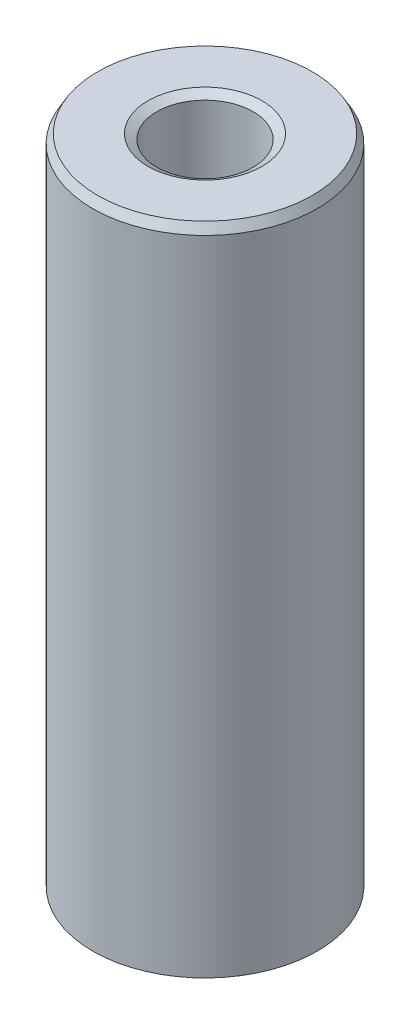
from build123d import *
from OCP.BRepFilletAPI import BRepFilletAPI_MakeChamfer

# Parameters (mm, degrees)
SKETCH1_R           = 32.5
BOSS_EXTRUDE1_DEPTH = 190.020085053
SKETCH2_R           = 13.937370065
CUT_EXTRUDE1_DEPTH  = 196.49970006
CHAMFER1_SIZE       = 2.545551972
CHAMFER1_SIZE2      = 1.469675116


with BuildPart() as part:
    # Sketch1 → Boss-Extrude1 (new body)
    with BuildSketch(Plane(origin=(0, 0, 0), x_dir=(1, 0, 0), z_dir=(0, 1, 0))):
        Circle(SKETCH1_R)
    extrude(amount=BOSS_EXTRUDE1_DEPTH)

    # Sketch2 → Cut-Extrude1 (cut, through all)
    with BuildSketch(Plane(origin=(0, 0, 0), x_dir=(1, 0, 0), z_dir=(0, 1, 0))):
        Circle(SKETCH2_R)
    extrude(amount=CUT_EXTRUDE1_DEPTH, mode=Mode.SUBTRACT)

    # Chamfer1: one chamfer whose edges measure the first distance from different faces: ONE call of the kernel's chamfer builder (chamfer() names one face for all edges)
    chamfer1_edges_1 = [part.edges().sort_by_distance(p)[0] for p in [
        (-13.937370065, 190.020085053, 0),
    ]]
    chamfer1_side_1 = [part.faces().sort_by_distance(p)[0] for p in [
        (-31.580761184, 190.020085053, 0),
    ]]
    chamfer1_edges_2 = [part.edges().sort_by_distance(p)[0] for p in [
        (-13.937370065, 0, 0),
    ]]
    chamfer1_side_2 = [part.faces().sort_by_distance(p)[0] for p in [
        (-13.937370065, 95.010042527, 0),
    ]]
    chamfer1_edges_3 = [part.edges().sort_by_distance(p)[0] for p in [
        (-32.5, 0, 0),
    ]]
    chamfer1_side_3 = [part.faces().sort_by_distance(p)[0] for p in [
        (-31.580761184, 0, 0),
    ]]
    chamfer1_edges_4 = [part.edges().sort_by_distance(p)[0] for p in [
        (-32.5, 190.020085053, 0),
    ]]
    chamfer1_side_4 = [part.faces().sort_by_distance(p)[0] for p in [
        (-32.5, 95.010042527, 0),
    ]]
    chamfer1 = BRepFilletAPI_MakeChamfer(part.part.solid().wrapped)
    for e in chamfer1_edges_1:
        chamfer1.Add(CHAMFER1_SIZE, CHAMFER1_SIZE2, e.wrapped, chamfer1_side_1[0].wrapped)  # the first distance lies on this face
    for e in chamfer1_edges_2:
        chamfer1.Add(CHAMFER1_SIZE, CHAMFER1_SIZE2, e.wrapped, chamfer1_side_2[0].wrapped)  # the first distance lies on this face
    for e in chamfer1_edges_3:
        chamfer1.Add(CHAMFER1_SIZE, CHAMFER1_SIZE2, e.wrapped, chamfer1_side_3[0].wrapped)  # the first distance lies on this face
    for e in chamfer1_edges_4:
        chamfer1.Add(CHAMFER1_SIZE, CHAMFER1_SIZE2, e.wrapped, chamfer1_side_4[0].wrapped)  # the first distance lies on this face
    add(Compound.cast(chamfer1.Shape()), mode=Mode.REPLACE)


solid = part.part
